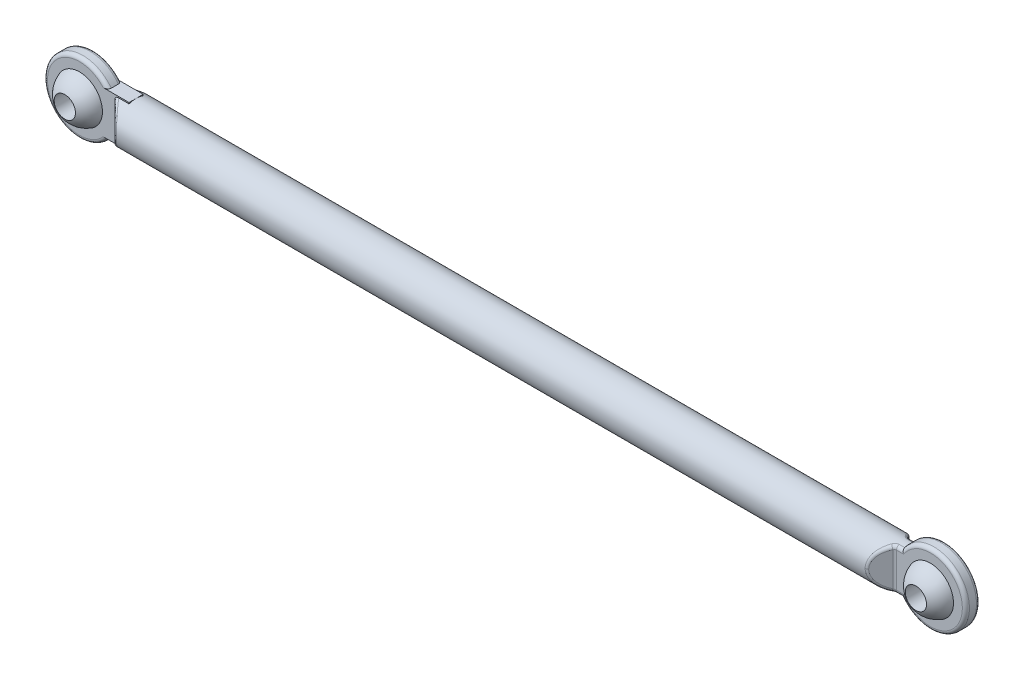
from build123d import *

# Parameters (mm, degrees)
EXTRUDE_1_DEPTH     = 1
SKETCH_2_W          = 106
SKETCH_2_H          = 6
EXTRUDE_2_DEPTH     = 2
SKETCH_3_OUTSIDE_W  = 33.258
SKETCH_3_OUTSIDE_H  = 33.258
SKETCH_3_OUTSIDE_R  = 3
CUT_EXTRUDE_2_DEPTH = 114
SKETCH_4_R          = 5
EXTRUDE_3_DEPTH     = 2
CHAMFER_1_SIZE      = 2
FILLET_2_R          = 0.5
SKETCH_7_R          = 1.5
CUT_EXTRUDE_3_DEPTH = 126.146154659


with BuildPart() as part:
    # 草图1 → 凸台-拉伸1 (new body)
    with BuildSketch(Plane.XY):
        with BuildLine():
            Line((0, 3), (120, 3))
            ThreePointArc((120, 3), (123, 0), (120, -3))
            Line((120, -3), (0, -3))
            ThreePointArc((0, -3), (-3, 0), (0, 3))
        make_face()
    extrude_1 = extrude(amount=EXTRUDE_1_DEPTH)

    # 草图2 → 凸台-拉伸2 (add)
    with BuildSketch(Plane.XY.offset(1)):
        with Locations((60, 0)):
            Rectangle(SKETCH_2_W, SKETCH_2_H)
    extrude_2 = extrude(amount=EXTRUDE_2_DEPTH)

    # 镜向2: 凸台-拉伸1, 凸台-拉伸2 across plane
    add(extrude_1.mirror(Plane.XY))
    add(extrude_2.mirror(Plane.XY))

    # 草图3 outside → 切除-拉伸2 (cut)
    with BuildSketch(Plane.ZY.offset(-7)):
        Rectangle(SKETCH_3_OUTSIDE_W, SKETCH_3_OUTSIDE_H)
        with Locations(Location((0, 0, 0), (0, 0, 270))):
            Circle(SKETCH_3_OUTSIDE_R, mode=Mode.SUBTRACT)
    extrude(amount=-CUT_EXTRUDE_2_DEPTH, mode=Mode.SUBTRACT)

    # 草图4 → 凸台-拉伸3 (add)
    with BuildSketch(Plane.XY.offset(1)):
        Circle(SKETCH_4_R)
        with Locations((120, 0)):
            Circle(SKETCH_4_R)
    extrude(amount=-EXTRUDE_3_DEPTH)

    # 倒角1
    # the kernel refuses this chamfer: 2 mm, written as the material it adds along each edge
    with BuildSketch(Plane(origin=(113, 7.971793101, 1), x_dir=(0.9996219169112968, 0, -0.027495876610586306), z_dir=(0, -1, 0))) as chamfer_1_piece_1_section:
        Polygon((CHAMFER_1_SIZE * 0.999621916911, CHAMFER_1_SIZE * 0.0274958766106), (-CHAMFER_1_SIZE * 0.0274958766106, CHAMFER_1_SIZE * 0.999621916911), (0, 0), align=None)
    chamfer_1_piece_1 = extrude(amount=15.943586201, mode=Mode.PRIVATE)
    chamfer_1_piece_1 = chamfer_1_piece_1 & Plane(origin=(113.704496688, 0, 0), x_dir=(0, -1, 0), z_dir=(-1, 0, 0)) * Cylinder(3, 40, mode=Mode.PRIVATE)
    add(chamfer_1_piece_1)
    with BuildSketch(Plane(origin=(113, 7.971793101, -1), x_dir=(0.9996219169112968, 0, 0.027495876610586306), z_dir=(0, -1, 0))) as chamfer_1_piece_2_section:
        Polygon((CHAMFER_1_SIZE * 0.999621916911, -CHAMFER_1_SIZE * 0.0274958766106), (-CHAMFER_1_SIZE * 0.0274958766106, -CHAMFER_1_SIZE * 0.999621916911), (0, 0), align=None)
    chamfer_1_piece_2 = extrude(amount=15.943586201, mode=Mode.PRIVATE)
    chamfer_1_piece_2 = chamfer_1_piece_2 & Plane(origin=(113.704496688, 0, 0), x_dir=(0, -1, 0), z_dir=(-1, 0, 0)) * Cylinder(3, 40, mode=Mode.PRIVATE)
    add(chamfer_1_piece_2)
    with BuildSketch(Plane(origin=(7, -7.971793101, -1), x_dir=(-0.9996219169112968, 0, 0.02749587661058638), z_dir=(0, 1, 0))) as chamfer_1_piece_3_section:
        Polygon((CHAMFER_1_SIZE * 0.999621916911, -CHAMFER_1_SIZE * 0.0274958766106), (-CHAMFER_1_SIZE * 0.0274958766106, -CHAMFER_1_SIZE * 0.999621916911), (0, 0), align=None)
    chamfer_1_piece_3 = extrude(amount=15.943586201, mode=Mode.PRIVATE)
    chamfer_1_piece_3 = chamfer_1_piece_3 & Plane(origin=(6.295503312, 0, 0), x_dir=(0, -1, 0), z_dir=(-1, 0, 0)) * Cylinder(3, 40, mode=Mode.PRIVATE)
    add(chamfer_1_piece_3)
    with BuildSketch(Plane(origin=(7, -7.971793101, 1), x_dir=(0.027495876610586494, 0, 0.9996219169112968), z_dir=(0, 1, 0))) as chamfer_1_piece_4_section:
        Polygon((CHAMFER_1_SIZE * 0.999621916911, -CHAMFER_1_SIZE * 0.0274958766106), (-CHAMFER_1_SIZE * 0.0274958766106, -CHAMFER_1_SIZE * 0.999621916911), (0, 0), align=None)
    chamfer_1_piece_4 = extrude(amount=15.943586201, mode=Mode.PRIVATE)
    chamfer_1_piece_4 = chamfer_1_piece_4 & Plane(origin=(6.295503312, 0, 0), x_dir=(0, -1, 0), z_dir=(-1, 0, 0)) * Cylinder(3, 40, mode=Mode.PRIVATE)
    add(chamfer_1_piece_4)

    # 圆角2
    fillet_2_edges = [part.edges().sort_by_distance(p)[0] for p in [
        (115.438447187, -2.828427125, -1),
        (115.438447187, 2.828427125, 1),
        (-5, 0, -1),
        (-5, 0, 1),
        (125, 0, 1),
        (125, 0, -1),
        (115.438447187, -2.828427125, 1),
        (115, 0, 1),
        (115.438447187, 2.828427125, -1),
        (115, 0, -1),
        (113.654265538, 1.870168397, 2.345734462),
        (113.654265538, 1.870168397, -2.345734462),
        (6.345734462, -1.870168397, -2.345734462),
        (6.345734462, -1.870168397, 2.345734462),
    ]]
    fillet(fillet_2_edges, radius=FILLET_2_R)

    # 草图6 → 旋转2 (revolve)
    with BuildSketch(Plane.XY):
        with BuildLine():
            Line((0, 3.4), (0, -3.4))
            ThreePointArc((0, -3.4), (-3.4, 0), (0, 3.4))
        make_face()
    revolve_2 = revolve(axis=Axis((0, 3.4, 0), (0, -1, 0)))

    # 草图7 → 切除-拉伸3 (cut, symmetric)
    with BuildSketch(Plane.XY):
        Circle(SKETCH_7_R)
    cut_extrude_3 = extrude(amount=CUT_EXTRUDE_3_DEPTH, both=True, mode=Mode.SUBTRACT)

    # 镜向3: 旋转2, 切除-拉伸3 across plane
    add(revolve_2.mirror(Plane(origin=(60, 0, 0), x_dir=(0, 0, 1), z_dir=(1, 0, 0))))
    add(cut_extrude_3.mirror(Plane(origin=(60, 0, 0), x_dir=(0, 0, 1), z_dir=(1, 0, 0))), mode=Mode.SUBTRACT)


solid = part.part
